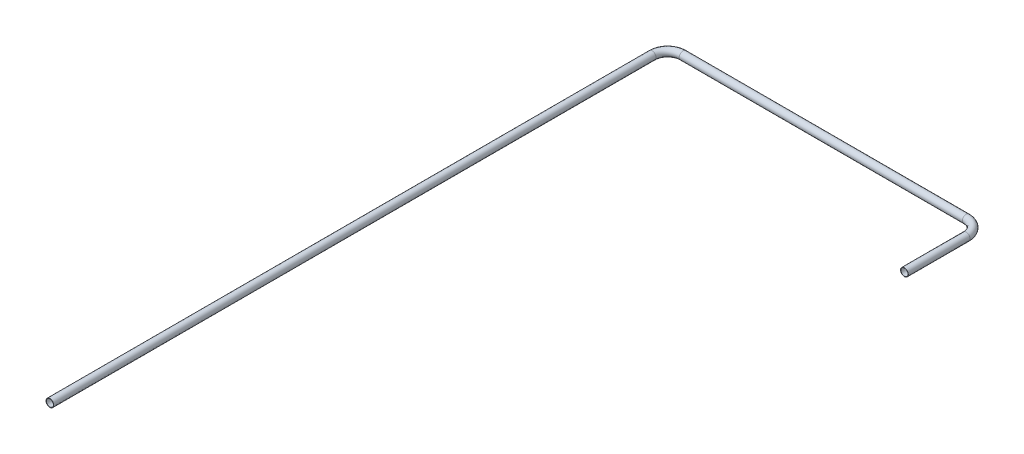
from build123d import *

# Parameters (mm, degrees)
SKETCH14_R   = 38.1
SKETCH14_R_2 = 34.925


with BuildPart() as part:
    # Sweep1: sweep along a path in Sketch13
    with BuildLine(Plane(origin=(0, 0, 0), x_dir=(1, 0, 0), z_dir=(0, 1, 0))) as sweep1_path:
        Line((-3098.8, -6096), (-3098.8, -152.4))
        ThreePointArc((-3098.8, -152.4), (-3054.163073453, -44.636926547), (-2946.4, 0))
        Line((-2946.4, 0), (-152.4, 0))
        ThreePointArc((-152.4, 0), (-44.636926547, -44.636926547), (0, -152.4))
        Line((0, -152.4), (0, -762))
    # Sketch14 → Sweep1 (sweep)
    with BuildSketch(Plane.XY.offset(762)):
        Circle(SKETCH14_R)
        Circle(SKETCH14_R_2, mode=Mode.SUBTRACT)
    sweep(path=sweep1_path.line)


solid = part.part
